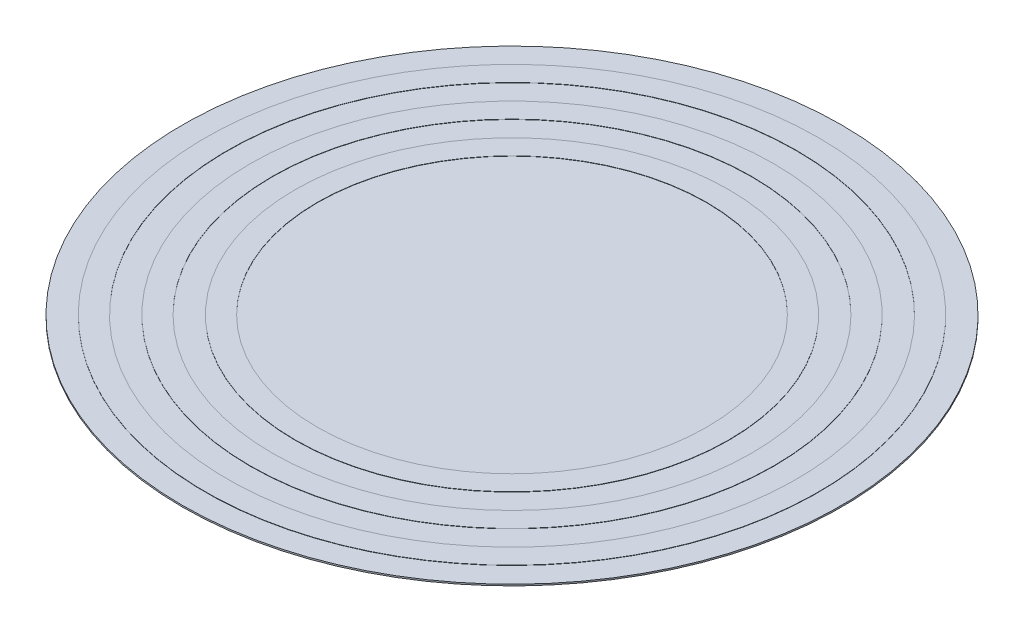
from build123d import *

# Parameters (mm, degrees)
SKETCH1_R           = 11
BOSS_EXTRUDE1_DEPTH = 0.05
SKETCH2_R           = 10.2366
SKETCH2_R_2         = 9.5
EXTRUDE_THIN2_DEPTH = 0.01
SKETCH17_R          = 8.7366
SKETCH17_R_2        = 8
EXTRUDE_THIN3_DEPTH = 0.01
SKETCH18_R          = 7.2366
SKETCH18_R_2        = 6.5
EXTRUDE_THIN4_DEPTH = 0.01


with BuildPart() as part:
    # Sketch1 → Boss-Extrude1 (new body)
    with BuildSketch(Plane(origin=(0, 0, 0), x_dir=(1, 0, 0), z_dir=(0, 1, 0))):
        Circle(SKETCH1_R)
    extrude(amount=BOSS_EXTRUDE1_DEPTH)



with BuildPart() as body_2:
    # Sketch2 → Extrude-Thin2 (new body)
    with BuildSketch(Plane(origin=(0, 0.05, 0), x_dir=(1, 0, 0), z_dir=(0, 1, 0))):
        Circle(SKETCH2_R)
        Circle(SKETCH2_R_2, mode=Mode.SUBTRACT)
    extrude(amount=EXTRUDE_THIN2_DEPTH)


with BuildPart() as part_1:
    add(part.part)

    add(body_2.part)  # Extrude-Thin3 merges body 2
    # Sketch17 → Extrude-Thin3 (add)
    with BuildSketch(Plane(origin=(0, 0.05, 0), x_dir=(1, 0, 0), z_dir=(0, 1, 0))):
        Circle(SKETCH17_R)
        Circle(SKETCH17_R_2, mode=Mode.SUBTRACT)
    extrude(amount=EXTRUDE_THIN3_DEPTH)

    # Sketch18 → Extrude-Thin4 (add)
    with BuildSketch(Plane(origin=(0, 0.05, 0), x_dir=(1, 0, 0), z_dir=(0, 1, 0))):
        Circle(SKETCH18_R)
        Circle(SKETCH18_R_2, mode=Mode.SUBTRACT)
    extrude(amount=EXTRUDE_THIN4_DEPTH)


solid = part_1.part
